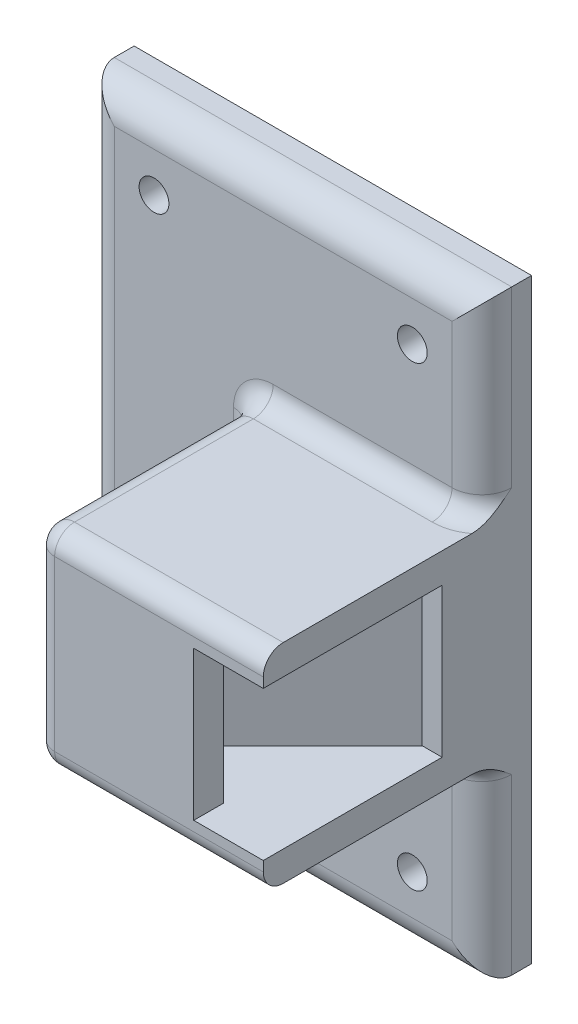
from build123d import *

# Parameters (mm, degrees)
SKETCH1_W           = 40
SKETCH1_H           = 60
SKETCH1_R           = 1.5
BOSS_EXTRUDE1_DEPTH = 5
SKETCH3_W           = 23
SKETCH3_H           = 21
BOSS_EXTRUDE2_DEPTH = 22
CUT_EXTRUDE1_START  = -3
SKETCH4_W           = 2
SKETCH4_H           = 15
CUT_EXTRUDE1_DEPTH  = 15
FILLET1_R           = 3
FILLET2_R           = 2


with BuildPart() as part:
    # Sketch1 → Boss-Extrude1 (new body)
    with BuildSketch(Plane.XY):
        with Locations((1.884057971, -16.449275362)):
            Rectangle(SKETCH1_W, SKETCH1_H)
        with Locations((14.884057971, 6.550724638)):
            Circle(SKETCH1_R, mode=Mode.SUBTRACT)
        with Locations(Location((14.884057971, -39.449275362, 0), (0, 0, 180))):
            Circle(SKETCH1_R, mode=Mode.SUBTRACT)
        with Locations((-11.115942029, -39.449275362)):
            Circle(SKETCH1_R, mode=Mode.SUBTRACT)
        with Locations(Location((-11.115942029, 6.550724638, 0), (0, 0, 180))):
            Circle(SKETCH1_R, mode=Mode.SUBTRACT)
    extrude(amount=BOSS_EXTRUDE1_DEPTH)

    # Sketch3 → Boss-Extrude2 (add)
    with BuildSketch(Plane.XY.offset(5)):
        with Locations((10.384057971, -16.449275362)):
            Rectangle(SKETCH3_W, SKETCH3_H)
    extrude(amount=BOSS_EXTRUDE2_DEPTH)

    # Sketch4 → Cut-Extrude1 (cut)
    with BuildSketch(Plane.XZ.offset(26.949275362).offset(CUT_EXTRUDE1_START)):
        with Locations((20.884057971, 16.5)):
            Rectangle(SKETCH4_W, SKETCH4_H)
        Polygon((14.884057971, 24), (14.884057971, 14), (19.884057971, 9), (19.884057971, 24), align=None)
        Polygon((14.884057971, 27), (14.884057971, 24), (19.884057971, 24), (21.884057971, 24), (21.884057971, 27), align=None)
        Polygon((14.884057971, 24), (4.884057971, 24), (14.884057971, 14), align=None)
    extrude(amount=-CUT_EXTRUDE1_DEPTH, mode=Mode.SUBTRACT)

    # Fillet1
    fillet1_edges = [part.edges().sort_by_distance(p)[0] for p in [
        (21.884057971, -36.699275362, 5),
        (1.884057971, 13.550724638, 5),
        (21.884057971, 3.800724638, 5),
        (-18.115942029, -16.449275362, 5),
        (1.884057971, -46.449275362, 5),
    ]]
    fillet(fillet1_edges, radius=FILLET1_R)

    # Fillet2
    # the kernel refuses this fillet: 2 mm, written as the material it takes off along each edge
    with BuildSketch(Plane(origin=(0.884057971, -7.949275362, 25), x_dir=(-1, 0, 0), z_dir=(0, 0, 1))) as fillet2_piece_1_section:
        Polygon((0, 0), (FILLET2_R * 1.02, 0), (FILLET2_R * 1.02, -FILLET2_R * 1.02), (0, -FILLET2_R * 1.02), align=None)
    fillet2_piece_1 = extrude(amount=FILLET2_R * 1.02, mode=Mode.PRIVATE)
    fillet2_piece_1 = fillet2_piece_1 - Plane(origin=(0.884057971, -7.949275362, 25), x_dir=(0.7071067811865475, -0.7071067811865475, 0), z_dir=(0, 0, 1)) * Sphere(FILLET2_R, mode=Mode.PRIVATE)
    add(fillet2_piece_1, mode=Mode.SUBTRACT)
    with BuildSketch(Plane(origin=(0.884057971, -24.949275362, 25), x_dir=(-1, 0, 0), z_dir=(0, 0, 1))) as fillet2_piece_2_section:
        Polygon((0, 0), (FILLET2_R * 1.02, 0), (FILLET2_R * 1.02, FILLET2_R * 1.02), (0, FILLET2_R * 1.02), align=None)
    fillet2_piece_2 = extrude(amount=FILLET2_R * 1.02, mode=Mode.PRIVATE)
    fillet2_piece_2 = fillet2_piece_2 - Plane(origin=(0.884057971, -24.949275362, 25), x_dir=(0.7071067811865475, 0.7071067811865475, 0), z_dir=(0, 0, 1)) * Sphere(FILLET2_R, mode=Mode.PRIVATE)
    add(fillet2_piece_2, mode=Mode.SUBTRACT)
    with BuildSketch(Plane(origin=(-1.115942029, -5.949275362, 5), x_dir=(0, -1, 0), z_dir=(0, 0, 1))) as fillet2_piece_3:
        with BuildLine():
            CenterArc((FILLET2_R, FILLET2_R), FILLET2_R, 180, 90)
            Line((0, FILLET2_R), (0, 0))
            Line((0, 0), (FILLET2_R, 0))
        make_face()
    extrude(amount=20, mode=Mode.SUBTRACT)
    with BuildSketch(Plane(origin=(-1.115942029, -26.949275362, 5), x_dir=(0, 1, 0), z_dir=(0, 0, 1))) as fillet2_piece_4:
        with BuildLine():
            CenterArc((FILLET2_R, -FILLET2_R), FILLET2_R, 90, 90)
            Line((0, -FILLET2_R), (0, 0))
            Line((0, 0), (FILLET2_R, 0))
        make_face()
    extrude(amount=20, mode=Mode.SUBTRACT)
    with BuildSketch(Plane(origin=(0.884057971, -5.949275362, 27), x_dir=(0, -1, 0), z_dir=(1, 0, 0))) as fillet2_piece_5:
        with BuildLine():
            CenterArc((FILLET2_R, FILLET2_R), FILLET2_R, 180, 90)
            Line((0, FILLET2_R), (0, 0))
            Line((0, 0), (FILLET2_R, 0))
        make_face()
    extrude(amount=26, mode=Mode.SUBTRACT)
    with BuildSketch(Plane(origin=(-1.115942029, -24.949275362, 27), x_dir=(0, 0, -1), z_dir=(0, 1, 0))) as fillet2_piece_6:
        with BuildLine():
            CenterArc((FILLET2_R, -FILLET2_R), FILLET2_R, 90, 90)
            Line((0, -FILLET2_R), (0, 0))
            Line((0, 0), (FILLET2_R, 0))
        make_face()
    extrude(amount=17, mode=Mode.SUBTRACT)
    with BuildSketch(Plane(origin=(26.884057971, -26.949275362, 27), x_dir=(0, 0, -1), z_dir=(-1, 0, 0))) as fillet2_piece_7:
        with BuildLine():
            CenterArc((FILLET2_R, -FILLET2_R), FILLET2_R, 90, 90)
            Line((0, -FILLET2_R), (0, 0))
            Line((0, 0), (FILLET2_R, 0))
        make_face()
    extrude(amount=26, mode=Mode.SUBTRACT)
    # the kernel refuses this fillet: 2 mm, written as the material it adds along each edge
    with BuildSketch(Plane(origin=(-1.115942029, -24.949275362, 5), x_dir=(-1, 0, 0), z_dir=(0, 1, 0))) as fillet2_2_piece_1:
        with BuildLine():
            CenterArc((FILLET2_R, FILLET2_R), FILLET2_R, 180, 90)
            Line((0, FILLET2_R), (0, 0))
            Line((0, 0), (FILLET2_R, 0))
        make_face()
    extrude(amount=17)
    with BuildSketch(Plane(origin=(18.884057971, -26.949275362, 5), x_dir=(0, -1, 0), z_dir=(-1, 0, 0)), Plane(origin=(0.884057971, -5.949275362, 5), x_dir=(0, 1, 0), z_dir=(1, 0, 0))) as fillet2_2_piece_2:
        with BuildLine():
            CenterArc((FILLET2_R, FILLET2_R), FILLET2_R, 180, 90)
            Line((0, FILLET2_R), (0, 0))
            Line((0, 0), (FILLET2_R, 0))
        make_face()
    extrude(amount=18)
    with BuildSketch(Plane(origin=(18.884057971, -5.949275362, 2), x_dir=(-0.09638996566753259, 0, -0.9953436464450918), z_dir=(-0.9953436464450918, 0, 0.09638996566753259))) as fillet2_2_piece_3_section:
        with BuildLine():
            CenterArc((3 + FILLET2_R, -FILLET2_R), FILLET2_R, 90, 90)
            Line((3 + FILLET2_R, 0), (3, 0))
            Line((3, 0), (3, -FILLET2_R))
        make_face()
    fillet2_2_piece_3 = revolve(axis=Axis((18.884057971, -5.949275362, 2), (0, -1, 0)), revolution_arc=185.531326158, mode=Mode.PRIVATE)
    fillet2_2_piece_3 = split(fillet2_2_piece_3, bisect_by=Plane(origin=(21.104944702, -5.375674968, 0), z_dir=(0, 0, 1)), keep=Keep.TOP, mode=Mode.PRIVATE)
    fillet2_2_piece_3 = split(fillet2_2_piece_3, bisect_by=Plane(origin=(21.884057971, -5.375674968, 4.220886685), z_dir=(-1, 0, 0)), keep=Keep.TOP, mode=Mode.PRIVATE)
    add(fillet2_2_piece_3)
    with BuildSketch(Plane(origin=(18.884057971, -26.949275362, 2), x_dir=(-0.09638996566753259, 0, -0.9953436464450918), z_dir=(-0.9953436464450918, 0, 0.09638996566753259))) as fillet2_2_piece_4_section:
        with BuildLine():
            CenterArc((3 + FILLET2_R, FILLET2_R), FILLET2_R, 180, 90)
            Line((3 + FILLET2_R, 0), (3, 0))
            Line((3, 0), (3, FILLET2_R))
        make_face()
    fillet2_2_piece_4 = revolve(axis=Axis((18.884057971, -26.949275362, 2), (0, -1, 0)), revolution_arc=185.531326158, mode=Mode.PRIVATE)
    fillet2_2_piece_4 = split(fillet2_2_piece_4, bisect_by=Plane(origin=(21.104944699, -27.522875755, 0), z_dir=(0, 0, 1)), keep=Keep.TOP, mode=Mode.PRIVATE)
    fillet2_2_piece_4 = split(fillet2_2_piece_4, bisect_by=Plane(origin=(21.884057971, -27.522875755, 4.220886633), z_dir=(-1, 0, 0)), keep=Keep.TOP, mode=Mode.PRIVATE)
    add(fillet2_2_piece_4)
    with BuildSketch(Plane(origin=(0.884057971, -7.949275362, 5), x_dir=(-1, 0, 0), z_dir=(0, -1, 0))) as fillet2_2_piece_5:
        with BuildLine():
            CenterArc((2 + FILLET2_R, -FILLET2_R), FILLET2_R, 90, 90)
            Line((2, -FILLET2_R), (2, 0))
            Line((2, 0), (2 + FILLET2_R, 0))
        make_face()
    revolve(axis=Axis((0.884057971, -7.949275362, 5), (0, 0, -1)), revolution_arc=90)
    with BuildSketch(Plane(origin=(0.884057971, -24.949275362, 5), x_dir=(-1, 0, 0), z_dir=(0, 1, 0))) as fillet2_2_piece_6:
        with BuildLine():
            CenterArc((2 + FILLET2_R, FILLET2_R), FILLET2_R, 180, 90)
            Line((2, FILLET2_R), (2, 0))
            Line((2, 0), (2 + FILLET2_R, 0))
        make_face()
    revolve(axis=Axis((0.884057971, -24.949275362, 5), (0, 0, 1)), revolution_arc=90)


solid = part.part
